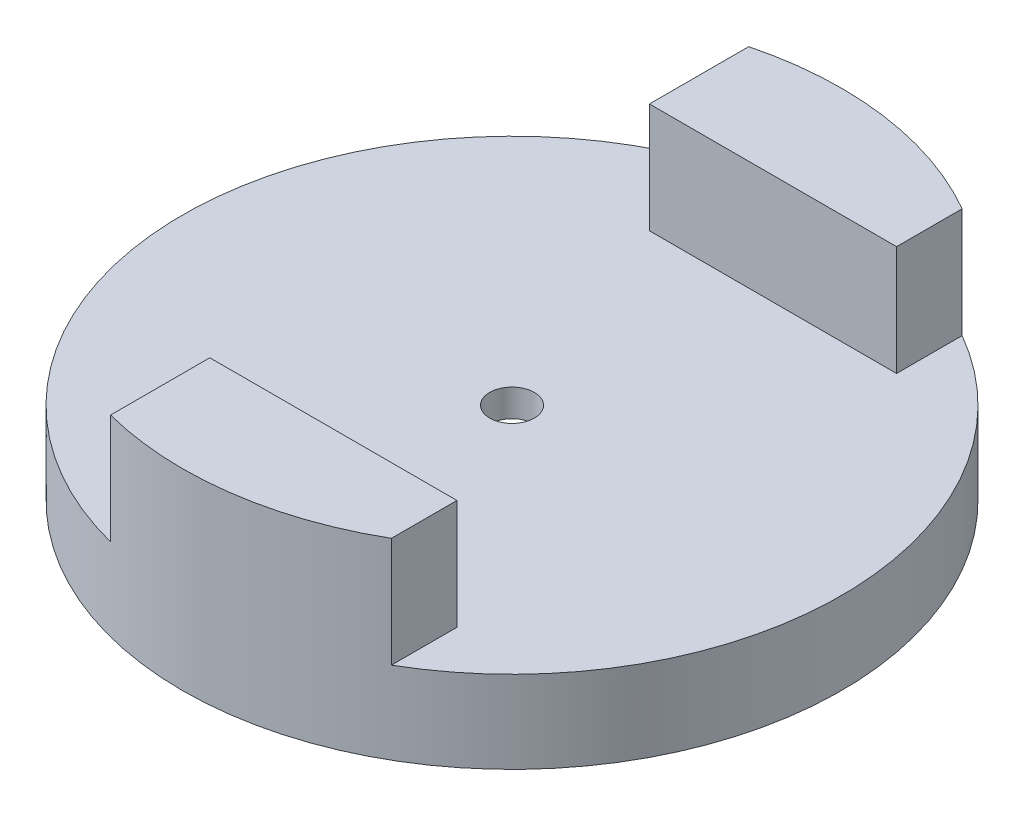
from build123d import *

# Parameters (mm, degrees)
SKETCH1_R                         = 5.159375
BOSS_EXTRUDE1_DEPTH               = 6.35
SKETCH1_3_R                       = 76.2
SKETCH1_3_R_2                     = 74.14006
BOSS_EXTRUDE2_DEPTH               = 19.05
BOSS_EXTRUDE3_START               = 25.4
BOSS_EXTRUDE3_DEPTH               = 25.4
PIPE_TAP_DRILL_FOR_3_8_TAP1_D     = 14.2748
PIPE_TAP_DRILL_FOR_3_8_TAP1_DEPTH = 30.48
PIPE_TAP_DRILL_FOR_3_8_TAP1_TIP   = 4.288582582


with BuildPart() as part:
    # Sketch1 → Boss-Extrude1 (new body)
    with BuildSketch(Plane(origin=(0, 0, 0), x_dir=(1, 0, 0), z_dir=(0, 1, 0))):
        with BuildLine():
            Line((38.1, -65.991135768), (38.1, -63.601403261))
            ThreePointArc((38.1, -63.601403261), (74.14006, 0), (38.1, 63.601403261))
            Line((38.1, 63.601403261), (38.1, 65.991135768))
            ThreePointArc((38.1, 65.991135768), (-76.2, 0), (38.1, -65.991135768))
        make_face()
        Circle(SKETCH1_R, mode=Mode.SUBTRACT)
    extrude(amount=-BOSS_EXTRUDE1_DEPTH)

    # Sketch1<3> → Boss-Extrude2 (add)
    with BuildSketch(Plane(origin=(0, 0, 0), x_dir=(1, 0, 0), z_dir=(0, 1, 0))):
        Circle(SKETCH1_3_R)
        Circle(SKETCH1_3_R_2, mode=Mode.SUBTRACT)
    extrude(amount=-BOSS_EXTRUDE2_DEPTH)

    # Sketch1<4> → Boss-Extrude3 (add)
    with BuildSketch(Plane(origin=(0, 0, 0), x_dir=(1, 0, 0), z_dir=(0, 1, 0)).offset(BOSS_EXTRUDE3_START)):
        with BuildLine():
            ThreePointArc((-19.05, -73.780332745), (10.290457832, -75.501963402), (38.1, -65.991135768))
            Line((38.1, -65.991135768), (38.1, -50.83048))
            Line((38.1, -50.83048), (-19.05, -50.83048))
            Line((-19.05, -50.83048), (-19.05, -73.780332745))
        make_face()
        with BuildLine():
            ThreePointArc((38.1, 65.991135768), (10.290457832, 75.501963402), (-19.05, 73.780332745))
            Line((-19.05, 73.780332745), (-19.05, 50.83048))
            Line((-19.05, 50.83048), (38.1, 50.83048))
            Line((38.1, 50.83048), (38.1, 65.991135768))
        make_face()
    extrude(amount=-BOSS_EXTRUDE3_DEPTH)

    # Pipe Tap Drill for 3/8 Tap1
    with Locations(Plane(origin=(-19.05, 12.7, -63.53048), x_dir=(0, 0, -1), z_dir=(-1, 0, 0))):
        with Locations((0, 0), (-127.06096, 0)):
            Hole(PIPE_TAP_DRILL_FOR_3_8_TAP1_D / 2, depth=PIPE_TAP_DRILL_FOR_3_8_TAP1_DEPTH)
            with Locations((0, 0, -(PIPE_TAP_DRILL_FOR_3_8_TAP1_DEPTH + PIPE_TAP_DRILL_FOR_3_8_TAP1_TIP / 2))):  # 118° drill point
                Cone(0, PIPE_TAP_DRILL_FOR_3_8_TAP1_D / 2, PIPE_TAP_DRILL_FOR_3_8_TAP1_TIP, mode=Mode.SUBTRACT)


solid = part.part
